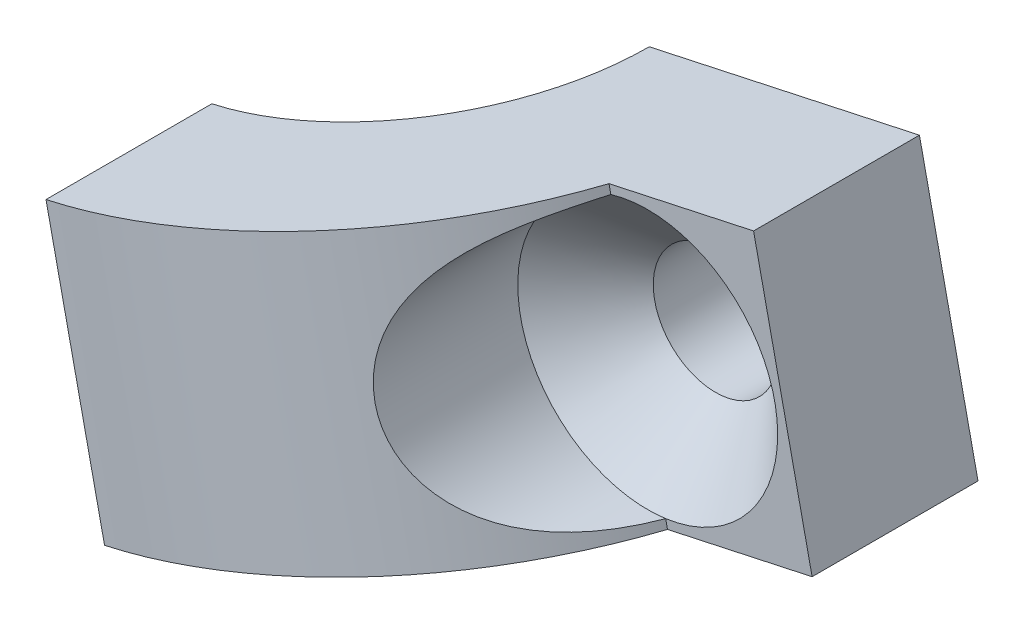
from build123d import *

# Parameters (mm, degrees)
EXTRUDE_1_DEPTH     = 5
CUT_EXTRUDE_1_REACH = 109.797
SKETCH_2_R          = 4.7


# Read off the part's stored shape, not the designer's step: 高级异型孔1
with BuildPart() as part:
    # 草图1 → 凸台-拉伸1 (new, symmetric)
    with BuildSketch(Plane(origin=(-126.798228997, -64.222453956, -29.938468974), x_dir=(0, 0, -1), z_dir=(-0.21174441426742976, 0.9773250754107066, 0))):
        with BuildLine():
            Line((-40, -48), (-40, -58))
            Line((-40, -58), (-46, -58))
            Line((-46, -58), (-46, -52.649110641))
            ThreePointArc((-46, -52.649110641), (-51.832159566, -47.483314774), (-54, -40))
            Line((-54, -40), (-48, -40))
            ThreePointArc((-48, -40), (-45.656854249, -45.656854249), (-40, -48))
        make_face()
    extrude(amount=EXTRUDE_1_DEPTH, both=True)

    # 高级异型孔1 outline → 高级异型孔1 (revolve, cut)
    with BuildSketch(Plane(origin=(-75, -53, 0), x_dir=(1, 0, 0), z_dir=(0, -1, 0))):
        Polygon((0, 10.061531026), (2.25, 10.061531026), (2.25, 13.611531026), (4.7, 16.061531026), (0, 16.061531026), align=None)
    revolve(axis=Axis((-75, -53, 0), (0, 0, 1)), mode=Mode.SUBTRACT)

    # 草图2 → 切除-拉伸1 (cut, up to next)
    with BuildSketch(Plane.XY.offset(16.061531026), mode=Mode.PRIVATE) as cut_extrude_1_sk1:
        with Locations((-75, -53)):
            Circle(SKETCH_2_R)
    cut_extrude_1_tool1 = extrude(cut_extrude_1_sk1.sketch, amount=CUT_EXTRUDE_1_REACH, mode=Mode.PRIVATE) & part.part
    add(cut_extrude_1_tool1.solids().sort_by_distance((-75, -53, 16.061531))[0], mode=Mode.SUBTRACT)


solid = part.part
